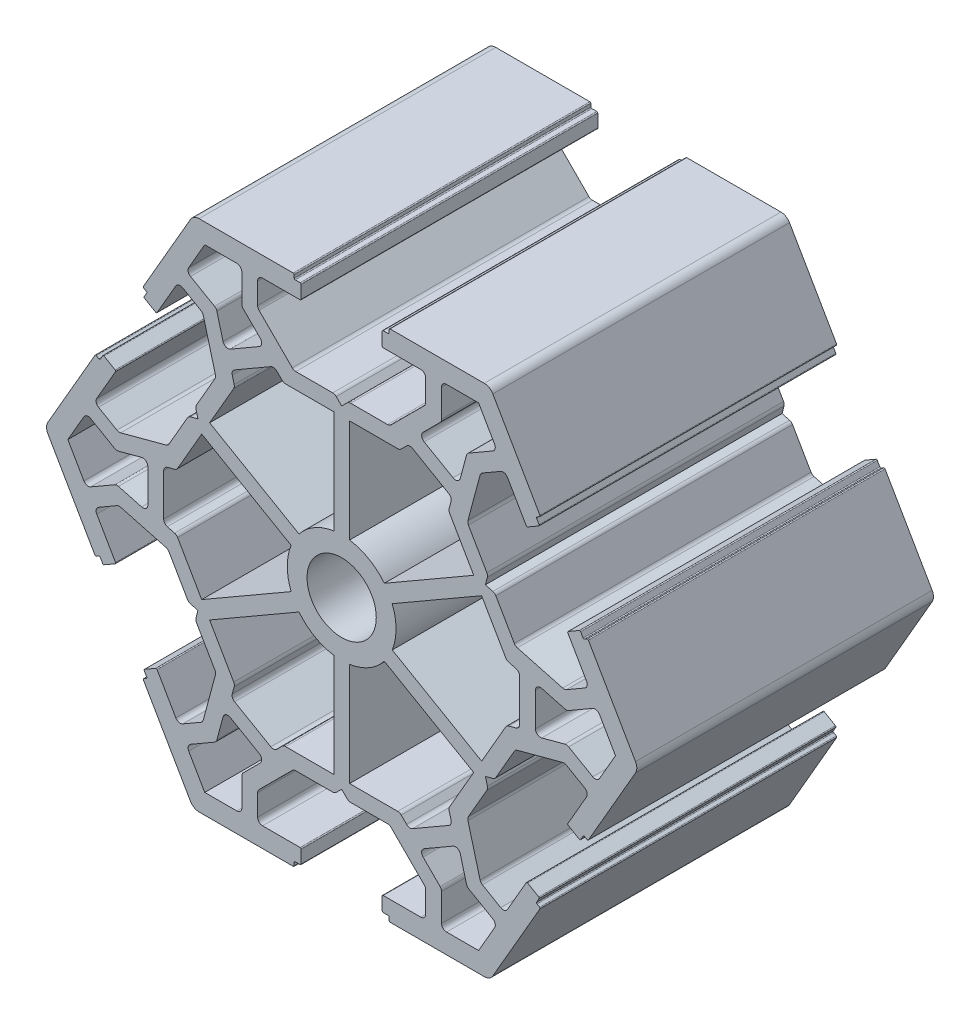
from build123d import *

# Parameters (mm, degrees)
IZIM1_R                     = 3.5
Y_KSEKLIK_EKSTR_ZYON1_DEPTH = 30


with BuildPart() as part:
    # Çizim1 → Yükseklik-Ekstrüzyon1 (new body)
    with BuildSketch(Plane.XY):
        with BuildLine():
            ThreePointArc((-14.422649731, 25.980762114), (-14.922649731, 25.846787517), (-15.288675135, 25.480762114))
            Line((-15.288675135, 25.480762114), (-20.05, 17.233905535))
            ThreePointArc((-20.05, 17.233905535), (-20.059990042, 17.158023631), (-20.01339746, 17.097302995))
            Line((-20.01339746, 17.097302995), (-19.753589838, 16.947302995))
            ThreePointArc((-19.753589838, 16.947302995), (-19.706997256, 16.886582359), (-19.716987298, 16.810700455))
            Line((-19.716987298, 16.810700455), (-19.966987298, 16.377687753))
            ThreePointArc((-19.966987298, 16.377687753), (-19.97697734, 16.301805848), (-19.930384758, 16.241085212))
            Line((-19.930384758, 16.241085212), (-18.804551733, 15.591085212))
            ThreePointArc((-18.804551733, 15.591085212), (-18.728669828, 15.58109517), (-18.667949192, 15.627687753))
            Line((-18.667949192, 15.627687753), (-16.767949192, 18.918584287))
            ThreePointArc((-16.767949192, 18.918584287), (-16.464346013, 19.1515472), (-16.084936491, 19.101596989))
            Line((-16.084936491, 19.101596989), (-14.229136525, 18.03015038))
            ThreePointArc((-14.229136525, 18.03015038), (-14.082459855, 17.901518392), (-13.996173612, 17.7265472))
            Line((-13.996173612, 17.7265472), (-12.767387247, 13.140654054))
            ThreePointArc((-12.767387247, 13.140654054), (-12.75462773, 12.945981435), (-12.817337458, 12.761244531))
            Line((-12.817337458, 12.761244531), (-14.685230677, 9.525958573))
            ThreePointArc((-14.685230677, 9.525958573), (-14.747940406, 9.341221669), (-14.735180888, 9.146549051))
            Line((-14.735180888, 9.146549051), (-14.532566285, 8.390381057))
            Line((-14.532566285, 8.390381057), (-15.288734279, 8.187766453))
            ThreePointArc((-15.288734279, 8.187766453), (-15.463705471, 8.10148021), (-15.592337458, 7.95480354))
            Line((-15.592337458, 7.95480354), (-17.460230677, 4.719517582))
            ThreePointArc((-17.460230677, 4.719517582), (-17.588862665, 4.572840912), (-17.763833857, 4.486554669))
            Line((-17.763833857, 4.486554669), (-22.349727003, 3.257768304))
            ThreePointArc((-22.349727003, 3.257768304), (-22.544399622, 3.245008786), (-22.729136525, 3.307718515))
            Line((-22.729136525, 3.307718515), (-24.584936491, 4.379165125))
            ThreePointArc((-24.584936491, 4.379165125), (-24.817899404, 4.682768304), (-24.767949192, 5.062177826))
            Line((-24.767949192, 5.062177826), (-22.867949192, 8.353074361))
            ThreePointArc((-22.867949192, 8.353074361), (-22.85795915, 8.428956265), (-22.904551733, 8.489676901))
            Line((-22.904551733, 8.489676901), (-24.030384758, 9.139676901))
            ThreePointArc((-24.030384758, 9.139676901), (-24.106266662, 9.149666944), (-24.166987298, 9.103074361))
            Line((-24.166987298, 9.103074361), (-24.416987298, 8.670061659))
            ThreePointArc((-24.416987298, 8.670061659), (-24.477707934, 8.623469076), (-24.553589838, 8.633459119))
            Line((-24.553589838, 8.633459119), (-24.81339746, 8.783459119))
            ThreePointArc((-24.81339746, 8.783459119), (-24.889279364, 8.793449161), (-24.95, 8.746856578))
            Line((-24.95, 8.746856578), (-29.711324865, 0.5))
            ThreePointArc((-29.711324865, 0.5), (-29.845299462, 0), (-29.711324865, -0.5))
            Line((-29.711324865, -0.5), (-24.95, -8.746856578))
            ThreePointArc((-24.95, -8.746856578), (-24.889279364, -8.793449161), (-24.81339746, -8.783459119))
            Line((-24.81339746, -8.783459119), (-24.553589838, -8.633459119))
            ThreePointArc((-24.553589838, -8.633459119), (-24.477707934, -8.623469076), (-24.416987298, -8.670061659))
            Line((-24.416987298, -8.670061659), (-24.166987298, -9.103074361))
            ThreePointArc((-24.166987298, -9.103074361), (-24.106266662, -9.149666944), (-24.030384758, -9.139676901))
            Line((-24.030384758, -9.139676901), (-22.904551733, -8.489676901))
            ThreePointArc((-22.904551733, -8.489676901), (-22.85795915, -8.428956265), (-22.867949192, -8.353074361))
            Line((-22.867949192, -8.353074361), (-24.767949192, -5.062177826))
            ThreePointArc((-24.767949192, -5.062177826), (-24.817899404, -4.682768304), (-24.584936491, -4.379165125))
            Line((-24.584936491, -4.379165125), (-22.729136525, -3.307718515))
            ThreePointArc((-22.729136525, -3.307718515), (-22.544399622, -3.245008786), (-22.349727003, -3.257768304))
            Line((-22.349727003, -3.257768304), (-17.763833857, -4.486554669))
            ThreePointArc((-17.763833857, -4.486554669), (-17.588862665, -4.572840912), (-17.460230677, -4.719517582))
            Line((-17.460230677, -4.719517582), (-15.592337458, -7.95480354))
            ThreePointArc((-15.592337458, -7.95480354), (-15.463705471, -8.10148021), (-15.288734279, -8.187766453))
            Line((-15.288734279, -8.187766453), (-14.532566285, -8.390381057))
            Line((-14.532566285, -8.390381057), (-14.735180888, -9.146549051))
            ThreePointArc((-14.735180888, -9.146549051), (-14.747940406, -9.341221669), (-14.685230677, -9.525958573))
            Line((-14.685230677, -9.525958573), (-12.817337458, -12.761244531))
            ThreePointArc((-12.817337458, -12.761244531), (-12.75462773, -12.945981435), (-12.767387247, -13.140654054))
            Line((-12.767387247, -13.140654054), (-13.996173612, -17.7265472))
            ThreePointArc((-13.996173612, -17.7265472), (-14.082459855, -17.901518392), (-14.229136525, -18.03015038))
            Line((-14.229136525, -18.03015038), (-16.084936491, -19.101596989))
            ThreePointArc((-16.084936491, -19.101596989), (-16.464346013, -19.1515472), (-16.767949192, -18.918584287))
            Line((-16.767949192, -18.918584287), (-18.667949192, -15.627687753))
            ThreePointArc((-18.667949192, -15.627687753), (-18.728669828, -15.58109517), (-18.804551733, -15.591085212))
            Line((-18.804551733, -15.591085212), (-19.930384758, -16.241085212))
            ThreePointArc((-19.930384758, -16.241085212), (-19.97697734, -16.301805848), (-19.966987298, -16.377687753))
            Line((-19.966987298, -16.377687753), (-19.716987298, -16.810700455))
            ThreePointArc((-19.716987298, -16.810700455), (-19.706997256, -16.886582359), (-19.753589838, -16.947302995))
            Line((-19.753589838, -16.947302995), (-20.01339746, -17.097302995))
            ThreePointArc((-20.01339746, -17.097302995), (-20.059990042, -17.158023631), (-20.05, -17.233905535))
            Line((-20.05, -17.233905535), (-15.288675135, -25.480762114))
            ThreePointArc((-15.288675135, -25.480762114), (-14.922649731, -25.846787517), (-14.422649731, -25.980762114))
            Line((-14.422649731, -25.980762114), (-4.9, -25.980762114))
            ThreePointArc((-4.9, -25.980762114), (-4.829289322, -25.951472792), (-4.8, -25.880762114))
            Line((-4.8, -25.880762114), (-4.8, -25.580762114))
            ThreePointArc((-4.8, -25.580762114), (-4.770710678, -25.510051435), (-4.7, -25.480762114))
            Line((-4.7, -25.480762114), (-4.2, -25.480762114))
            ThreePointArc((-4.2, -25.480762114), (-4.129289322, -25.451472792), (-4.1, -25.380762114))
            Line((-4.1, -25.380762114), (-4.1, -24.080762114))
            ThreePointArc((-4.1, -24.080762114), (-4.129289322, -24.010051435), (-4.2, -23.980762114))
            Line((-4.2, -23.980762114), (-8, -23.980762114))
            ThreePointArc((-8, -23.980762114), (-8.353553391, -23.834315504), (-8.5, -23.480762114))
            Line((-8.5, -23.480762114), (-8.5, -21.337868895))
            ThreePointArc((-8.5, -21.337868895), (-8.461939766, -21.146527179), (-8.353553391, -20.984315504))
            Line((-8.353553391, -20.984315504), (-4.996446609, -17.627208723))
            ThreePointArc((-4.996446609, -17.627208723), (-4.834234935, -17.518822347), (-4.642893219, -17.480762114))
            Line((-4.642893219, -17.480762114), (-0.907106781, -17.480762114))
            ThreePointArc((-0.907106781, -17.480762114), (-0.715765065, -17.44270188), (-0.553553391, -17.334315504))
            Line((-0.553553391, -17.334315504), (0, -16.780762114))
            Line((0, -16.780762114), (0.553553391, -17.334315504))
            ThreePointArc((0.553553391, -17.334315504), (0.715765065, -17.44270188), (0.907106781, -17.480762114))
            Line((0.907106781, -17.480762114), (4.642893219, -17.480762114))
            ThreePointArc((4.642893219, -17.480762114), (4.834234935, -17.518822347), (4.996446609, -17.627208723))
            Line((4.996446609, -17.627208723), (8.353553391, -20.984315504))
            ThreePointArc((8.353553391, -20.984315504), (8.461939766, -21.146527179), (8.5, -21.337868895))
            Line((8.5, -21.337868895), (8.5, -23.480762114))
            ThreePointArc((8.5, -23.480762114), (8.353553391, -23.834315504), (8, -23.980762114))
            Line((8, -23.980762114), (4.2, -23.980762114))
            ThreePointArc((4.2, -23.980762114), (4.129289322, -24.010051435), (4.1, -24.080762114))
            Line((4.1, -24.080762114), (4.1, -25.380762114))
            ThreePointArc((4.1, -25.380762114), (4.129289322, -25.451472792), (4.2, -25.480762114))
            Line((4.2, -25.480762114), (4.7, -25.480762114))
            ThreePointArc((4.7, -25.480762114), (4.770710678, -25.510051435), (4.8, -25.580762114))
            Line((4.8, -25.580762114), (4.8, -25.880762114))
            ThreePointArc((4.8, -25.880762114), (4.829289322, -25.951472792), (4.9, -25.980762114))
            Line((4.9, -25.980762114), (14.422649731, -25.980762114))
            ThreePointArc((14.422649731, -25.980762114), (14.922649731, -25.846787517), (15.288675135, -25.480762114))
            Line((15.288675135, -25.480762114), (20.05, -17.233905535))
            ThreePointArc((20.05, -17.233905535), (20.059990042, -17.158023631), (20.01339746, -17.097302995))
            Line((20.01339746, -17.097302995), (19.753589838, -16.947302995))
            ThreePointArc((19.753589838, -16.947302995), (19.706997256, -16.886582359), (19.716987298, -16.810700455))
            Line((19.716987298, -16.810700455), (19.966987298, -16.377687753))
            ThreePointArc((19.966987298, -16.377687753), (19.97697734, -16.301805848), (19.930384758, -16.241085212))
            Line((19.930384758, -16.241085212), (18.804551733, -15.591085212))
            ThreePointArc((18.804551733, -15.591085212), (18.728669828, -15.58109517), (18.667949192, -15.627687753))
            Line((18.667949192, -15.627687753), (16.767949192, -18.918584287))
            ThreePointArc((16.767949192, -18.918584287), (16.464346013, -19.1515472), (16.084936491, -19.101596989))
            Line((16.084936491, -19.101596989), (14.229136525, -18.03015038))
            ThreePointArc((14.229136525, -18.03015038), (14.082459855, -17.901518392), (13.996173612, -17.7265472))
            Line((13.996173612, -17.7265472), (12.767387247, -13.140654054))
            ThreePointArc((12.767387247, -13.140654054), (12.75462773, -12.945981435), (12.817337458, -12.761244531))
            Line((12.817337458, -12.761244531), (14.685230677, -9.525958573))
            ThreePointArc((14.685230677, -9.525958573), (14.747940406, -9.341221669), (14.735180888, -9.146549051))
            Line((14.735180888, -9.146549051), (14.532566285, -8.390381057))
            Line((14.532566285, -8.390381057), (15.288734279, -8.187766453))
            ThreePointArc((15.288734279, -8.187766453), (15.463705471, -8.10148021), (15.592337458, -7.95480354))
            Line((15.592337458, -7.95480354), (17.460230677, -4.719517582))
            ThreePointArc((17.460230677, -4.719517582), (17.588862665, -4.572840912), (17.763833857, -4.486554669))
            Line((17.763833857, -4.486554669), (22.349727003, -3.257768304))
            ThreePointArc((22.349727003, -3.257768304), (22.544399622, -3.245008786), (22.729136525, -3.307718515))
            Line((22.729136525, -3.307718515), (24.584936491, -4.379165125))
            ThreePointArc((24.584936491, -4.379165125), (24.817899404, -4.682768304), (24.767949192, -5.062177826))
            Line((24.767949192, -5.062177826), (22.867949192, -8.353074361))
            ThreePointArc((22.867949192, -8.353074361), (22.85795915, -8.428956265), (22.904551733, -8.489676901))
            Line((22.904551733, -8.489676901), (24.030384758, -9.139676901))
            ThreePointArc((24.030384758, -9.139676901), (24.106266662, -9.149666944), (24.166987298, -9.103074361))
            Line((24.166987298, -9.103074361), (24.416987298, -8.670061659))
            ThreePointArc((24.416987298, -8.670061659), (24.477707934, -8.623469076), (24.553589838, -8.633459119))
            Line((24.553589838, -8.633459119), (24.81339746, -8.783459119))
            ThreePointArc((24.81339746, -8.783459119), (24.889279364, -8.793449161), (24.95, -8.746856578))
            Line((24.95, -8.746856578), (29.711324865, -0.5))
            ThreePointArc((29.711324865, -0.5), (29.845299462, 0), (29.711324865, 0.5))
            Line((29.711324865, 0.5), (24.95, 8.746856578))
            ThreePointArc((24.95, 8.746856578), (24.889279364, 8.793449161), (24.81339746, 8.783459119))
            Line((24.81339746, 8.783459119), (24.553589838, 8.633459119))
            ThreePointArc((24.553589838, 8.633459119), (24.477707934, 8.623469076), (24.416987298, 8.670061659))
            Line((24.416987298, 8.670061659), (24.166987298, 9.103074361))
            ThreePointArc((24.166987298, 9.103074361), (24.106266662, 9.149666944), (24.030384758, 9.139676901))
            Line((24.030384758, 9.139676901), (22.904551733, 8.489676901))
            ThreePointArc((22.904551733, 8.489676901), (22.85795915, 8.428956265), (22.867949192, 8.353074361))
            Line((22.867949192, 8.353074361), (24.767949192, 5.062177826))
            ThreePointArc((24.767949192, 5.062177826), (24.817899404, 4.682768304), (24.584936491, 4.379165125))
            Line((24.584936491, 4.379165125), (22.729136525, 3.307718515))
            ThreePointArc((22.729136525, 3.307718515), (22.544399622, 3.245008786), (22.349727003, 3.257768304))
            Line((22.349727003, 3.257768304), (17.763833857, 4.486554669))
            ThreePointArc((17.763833857, 4.486554669), (17.588862665, 4.572840912), (17.460230677, 4.719517582))
            Line((17.460230677, 4.719517582), (15.592337458, 7.95480354))
            ThreePointArc((15.592337458, 7.95480354), (15.463705471, 8.10148021), (15.288734279, 8.187766453))
            Line((15.288734279, 8.187766453), (14.532566285, 8.390381057))
            Line((14.532566285, 8.390381057), (14.735180888, 9.146549051))
            ThreePointArc((14.735180888, 9.146549051), (14.747940406, 9.341221669), (14.685230677, 9.525958573))
            Line((14.685230677, 9.525958573), (12.817337458, 12.761244531))
            ThreePointArc((12.817337458, 12.761244531), (12.75462773, 12.945981435), (12.767387247, 13.140654054))
            Line((12.767387247, 13.140654054), (13.996173612, 17.7265472))
            ThreePointArc((13.996173612, 17.7265472), (14.082459855, 17.901518392), (14.229136525, 18.03015038))
            Line((14.229136525, 18.03015038), (16.084936491, 19.101596989))
            ThreePointArc((16.084936491, 19.101596989), (16.464346013, 19.1515472), (16.767949192, 18.918584287))
            Line((16.767949192, 18.918584287), (18.667949192, 15.627687753))
            ThreePointArc((18.667949192, 15.627687753), (18.728669828, 15.58109517), (18.804551733, 15.591085212))
            Line((18.804551733, 15.591085212), (19.930384758, 16.241085212))
            ThreePointArc((19.930384758, 16.241085212), (19.97697734, 16.301805848), (19.966987298, 16.377687753))
            Line((19.966987298, 16.377687753), (19.716987298, 16.810700455))
            ThreePointArc((19.716987298, 16.810700455), (19.706997256, 16.886582359), (19.753589838, 16.947302995))
            Line((19.753589838, 16.947302995), (20.01339746, 17.097302995))
            ThreePointArc((20.01339746, 17.097302995), (20.059990042, 17.158023631), (20.05, 17.233905535))
            Line((20.05, 17.233905535), (15.288675135, 25.480762114))
            ThreePointArc((15.288675135, 25.480762114), (14.922649731, 25.846787517), (14.422649731, 25.980762114))
            Line((14.422649731, 25.980762114), (4.9, 25.980762114))
            ThreePointArc((4.9, 25.980762114), (4.829289322, 25.951472792), (4.8, 25.880762114))
            Line((4.8, 25.880762114), (4.8, 25.580762114))
            ThreePointArc((4.8, 25.580762114), (4.770710678, 25.510051435), (4.7, 25.480762114))
            Line((4.7, 25.480762114), (4.2, 25.480762114))
            ThreePointArc((4.2, 25.480762114), (4.129289322, 25.451472792), (4.1, 25.380762114))
            Line((4.1, 25.380762114), (4.1, 24.080762114))
            ThreePointArc((4.1, 24.080762114), (4.129289322, 24.010051435), (4.2, 23.980762114))
            Line((4.2, 23.980762114), (8, 23.980762114))
            ThreePointArc((8, 23.980762114), (8.353553391, 23.834315504), (8.5, 23.480762114))
            Line((8.5, 23.480762114), (8.5, 21.337868895))
            ThreePointArc((8.5, 21.337868895), (8.461939766, 21.146527179), (8.353553391, 20.984315504))
            Line((8.353553391, 20.984315504), (4.996446609, 17.627208723))
            ThreePointArc((4.996446609, 17.627208723), (4.834234935, 17.518822347), (4.642893219, 17.480762114))
            Line((4.642893219, 17.480762114), (0.907106781, 17.480762114))
            ThreePointArc((0.907106781, 17.480762114), (0.715765065, 17.44270188), (0.553553391, 17.334315504))
            Line((0.553553391, 17.334315504), (0, 16.780762114))
            Line((0, 16.780762114), (-0.553553391, 17.334315504))
            ThreePointArc((-0.553553391, 17.334315504), (-0.715765065, 17.44270188), (-0.907106781, 17.480762114))
            Line((-0.907106781, 17.480762114), (-4.642893219, 17.480762114))
            ThreePointArc((-4.642893219, 17.480762114), (-4.834234935, 17.518822347), (-4.996446609, 17.627208723))
            Line((-4.996446609, 17.627208723), (-8.353553391, 20.984315504))
            ThreePointArc((-8.353553391, 20.984315504), (-8.461939766, 21.146527179), (-8.5, 21.337868895))
            Line((-8.5, 21.337868895), (-8.5, 23.480762114))
            ThreePointArc((-8.5, 23.480762114), (-8.353553391, 23.834315504), (-8, 23.980762114))
            Line((-8, 23.980762114), (-4.2, 23.980762114))
            ThreePointArc((-4.2, 23.980762114), (-4.129289322, 24.010051435), (-4.1, 24.080762114))
            Line((-4.1, 24.080762114), (-4.1, 25.380762114))
            ThreePointArc((-4.1, 25.380762114), (-4.129289322, 25.451472792), (-4.2, 25.480762114))
            Line((-4.2, 25.480762114), (-4.7, 25.480762114))
            ThreePointArc((-4.7, 25.480762114), (-4.770710678, 25.510051435), (-4.8, 25.580762114))
            Line((-4.8, 25.580762114), (-4.8, 25.880762114))
            ThreePointArc((-4.8, 25.880762114), (-4.829289322, 25.951472792), (-4.9, 25.980762114))
            Line((-4.9, 25.980762114), (-14.422649731, 25.980762114))
        make_face()
        with BuildLine():
            Line((-10.6, -23.980762114), (-13.845299462, -23.980762114))
            Line((-13.845299462, -23.980762114), (-15.467949192, -21.170250337))
            ThreePointArc((-15.467949192, -21.170250337), (-15.517899404, -20.790840814), (-15.284936491, -20.487237635))
            Line((-15.284936491, -20.487237635), (-12.855185377, -19.084420176))
            ThreePointArc((-12.855185377, -19.084420176), (-12.708508707, -18.955788188), (-12.622222464, -18.780816996))
            Line((-12.622222464, -18.780816996), (-11.9935155, -16.434450664))
            ThreePointArc((-11.9935155, -16.434450664), (-11.701894303, -16.10192042), (-11.260552587, -16.130847485))
            Line((-11.260552587, -16.130847485), (-8.339447413, -17.817348344))
            ThreePointArc((-8.339447413, -17.817348344), (-8.093724982, -18.185097949), (-8.235894022, -18.603914436))
            Line((-8.235894022, -18.603914436), (-9.953553391, -20.321573804))
            ThreePointArc((-9.953553391, -20.321573804), (-10.061939766, -20.483785479), (-10.1, -20.675127195))
            Line((-10.1, -20.675127195), (-10.1, -23.480762114))
            ThreePointArc((-10.1, -23.480762114), (-10.246446609, -23.834315504), (-10.6, -23.980762114))
        make_face(mode=Mode.SUBTRACT)
        with BuildLine():
            Line((15.467949192, -21.170250337), (13.845299462, -23.980762114))
            Line((13.845299462, -23.980762114), (10.6, -23.980762114))
            ThreePointArc((10.6, -23.980762114), (10.246446609, -23.834315504), (10.1, -23.480762114))
            Line((10.1, -23.480762114), (10.1, -20.675127195))
            ThreePointArc((10.1, -20.675127195), (10.061939766, -20.483785479), (9.953553391, -20.321573804))
            Line((9.953553391, -20.321573804), (8.235894022, -18.603914436))
            ThreePointArc((8.235894022, -18.603914436), (8.093724982, -18.185097949), (8.339447413, -17.817348344))
            Line((8.339447413, -17.817348344), (11.260552587, -16.130847485))
            ThreePointArc((11.260552587, -16.130847485), (11.701894303, -16.10192042), (11.9935155, -16.434450664))
            Line((11.9935155, -16.434450664), (12.622222464, -18.780816996))
            ThreePointArc((12.622222464, -18.780816996), (12.708508707, -18.955788188), (12.855185377, -19.084420176))
            Line((12.855185377, -19.084420176), (15.284936491, -20.487237635))
            ThreePointArc((15.284936491, -20.487237635), (15.517899404, -20.790840814), (15.467949192, -21.170250337))
        make_face(mode=Mode.SUBTRACT)
        with BuildLine():
            Line((-4.312483422, 3.413573895), (-13.353143422, 8.63320138))
            Line((-13.353143422, 8.63320138), (-10.918076144, 12.850861624))
            ThreePointArc((-10.918076144, 12.850861624), (-10.855366416, 13.035598528), (-10.868125933, 13.230271147))
            Line((-10.868125933, 13.230271147), (-11.06576409, 13.967866791))
            ThreePointArc((-11.06576409, 13.967866791), (-11.044740943, 14.288618029), (-10.832801177, 14.530289015))
            Line((-10.832801177, 14.530289015), (-9, 15.588457268))
            Line((-9, 15.588457268), (-7.167198823, 16.646625521))
            ThreePointArc((-7.167198823, 16.646625521), (-6.851935727, 16.70933525), (-6.563645432, 16.56716621))
            Line((-6.563645432, 16.56716621), (-6.023687945, 16.027208723))
            ThreePointArc((-6.023687945, 16.027208723), (-5.861476271, 15.918822347), (-5.670134555, 15.880762114))
            Line((-5.670134555, 15.880762114), (-0.8, 15.880762114))
            Line((-0.8, 15.880762114), (-0.8, 5.441507144))
            ThreePointArc((-0.8, 5.441507144), (-2.75, 4.763139721), (-4.312483422, 3.413573895))
        make_face(mode=Mode.SUBTRACT)
        with BuildLine():
            Line((-14.153143422, 7.247560734), (-5.112483422, 2.027933249))
            ThreePointArc((-5.112483422, 2.027933249), (-5.5, 0), (-5.112483422, -2.027933249))
            Line((-5.112483422, -2.027933249), (-14.153143422, -7.247560734))
            Line((-14.153143422, -7.247560734), (-16.588210699, -3.029900489))
            ThreePointArc((-16.588210699, -3.029900489), (-16.716842687, -2.883223819), (-16.891813879, -2.796937576))
            Line((-16.891813879, -2.796937576), (-17.629409523, -2.599299419))
            ThreePointArc((-17.629409523, -2.599299419), (-17.89667667, -2.420717221), (-18, -2.116336506))
            Line((-18, -2.116336506), (-18, 2.116336506))
            ThreePointArc((-18, 2.116336506), (-17.89667667, 2.420717221), (-17.629409523, 2.599299419))
            Line((-17.629409523, 2.599299419), (-16.891813879, 2.796937576))
            ThreePointArc((-16.891813879, 2.796937576), (-16.716842687, 2.883223819), (-16.588210699, 3.029900489))
            Line((-16.588210699, 3.029900489), (-14.153143422, 7.247560734))
        make_face(mode=Mode.SUBTRACT)
        with BuildLine():
            Line((-13.353143422, -8.63320138), (-4.312483422, -3.413573895))
            ThreePointArc((-4.312483422, -3.413573895), (-2.75, -4.763139721), (-0.8, -5.441507144))
            Line((-0.8, -5.441507144), (-0.8, -15.880762114))
            Line((-0.8, -15.880762114), (-5.670134555, -15.880762114))
            ThreePointArc((-5.670134555, -15.880762114), (-5.861476271, -15.918822347), (-6.023687945, -16.027208723))
            Line((-6.023687945, -16.027208723), (-6.563645432, -16.56716621))
            ThreePointArc((-6.563645432, -16.56716621), (-6.851935727, -16.70933525), (-7.167198823, -16.646625521))
            Line((-7.167198823, -16.646625521), (-10.832801177, -14.530289015))
            ThreePointArc((-10.832801177, -14.530289015), (-11.044740943, -14.288618029), (-11.06576409, -13.967866791))
            Line((-11.06576409, -13.967866791), (-10.868125933, -13.230271147))
            ThreePointArc((-10.868125933, -13.230271147), (-10.855366416, -13.035598528), (-10.918076144, -12.850861624))
            Line((-10.918076144, -12.850861624), (-13.353143422, -8.63320138))
        make_face(mode=Mode.SUBTRACT)
        with BuildLine():
            Line((0.8, -15.880762114), (0.8, -5.441507144))
            ThreePointArc((0.8, -5.441507144), (2.75, -4.763139721), (4.312483422, -3.413573895))
            Line((4.312483422, -3.413573895), (13.353143422, -8.63320138))
            Line((13.353143422, -8.63320138), (10.918076144, -12.850861624))
            ThreePointArc((10.918076144, -12.850861624), (10.855366416, -13.035598528), (10.868125933, -13.230271147))
            Line((10.868125933, -13.230271147), (11.06576409, -13.967866791))
            ThreePointArc((11.06576409, -13.967866791), (11.044740943, -14.288618029), (10.832801177, -14.530289015))
            Line((10.832801177, -14.530289015), (7.167198823, -16.646625521))
            ThreePointArc((7.167198823, -16.646625521), (6.851935727, -16.70933525), (6.563645432, -16.56716621))
            Line((6.563645432, -16.56716621), (6.023687945, -16.027208723))
            ThreePointArc((6.023687945, -16.027208723), (5.861476271, -15.918822347), (5.670134555, -15.880762114))
            Line((5.670134555, -15.880762114), (0.8, -15.880762114))
        make_face(mode=Mode.SUBTRACT)
        with BuildLine():
            Line((14.153143422, -7.247560734), (5.112483422, -2.027933249))
            ThreePointArc((5.112483422, -2.027933249), (5.5, 0), (5.112483422, 2.027933249))
            Line((5.112483422, 2.027933249), (14.153143422, 7.247560734))
            Line((14.153143422, 7.247560734), (16.588210699, 3.029900489))
            ThreePointArc((16.588210699, 3.029900489), (16.716842687, 2.883223819), (16.891813879, 2.796937576))
            Line((16.891813879, 2.796937576), (17.629409523, 2.599299419))
            ThreePointArc((17.629409523, 2.599299419), (17.89667667, 2.420717221), (18, 2.116336506))
            Line((18, 2.116336506), (18, -2.116336506))
            ThreePointArc((18, -2.116336506), (17.89667667, -2.420717221), (17.629409523, -2.599299419))
            Line((17.629409523, -2.599299419), (16.891813879, -2.796937576))
            ThreePointArc((16.891813879, -2.796937576), (16.716842687, -2.883223819), (16.588210699, -3.029900489))
            Line((16.588210699, -3.029900489), (14.153143422, -7.247560734))
        make_face(mode=Mode.SUBTRACT)
        with BuildLine():
            Line((13.353143422, 8.63320138), (4.312483422, 3.413573895))
            ThreePointArc((4.312483422, 3.413573895), (2.75, 4.763139721), (0.8, 5.441507144))
            Line((0.8, 5.441507144), (0.8, 15.880762114))
            Line((0.8, 15.880762114), (5.670134555, 15.880762114))
            ThreePointArc((5.670134555, 15.880762114), (5.861476271, 15.918822347), (6.023687945, 16.027208723))
            Line((6.023687945, 16.027208723), (6.563645432, 16.56716621))
            ThreePointArc((6.563645432, 16.56716621), (6.851935727, 16.70933525), (7.167198823, 16.646625521))
            Line((7.167198823, 16.646625521), (10.832801177, 14.530289015))
            ThreePointArc((10.832801177, 14.530289015), (11.044740943, 14.288618029), (11.06576409, 13.967866791))
            Line((11.06576409, 13.967866791), (10.868125933, 13.230271147))
            ThreePointArc((10.868125933, 13.230271147), (10.855366416, 13.035598528), (10.918076144, 12.850861624))
            Line((10.918076144, 12.850861624), (13.353143422, 8.63320138))
        make_face(mode=Mode.SUBTRACT)
        with BuildLine():
            Line((26.067949192, 2.810511777), (27.690598923, 0))
            Line((27.690598923, 0), (26.067949192, -2.810511777))
            ThreePointArc((26.067949192, -2.810511777), (25.764346013, -3.04347469), (25.384936491, -2.993524479))
            Line((25.384936491, -2.993524479), (22.955185377, -1.590707019))
            ThreePointArc((22.955185377, -1.590707019), (22.770448473, -1.52799729), (22.575775855, -1.540756808))
            Line((22.575775855, -1.540756808), (20.229409523, -2.169463772))
            ThreePointArc((20.229409523, -2.169463772), (19.795619285, -2.083177529), (19.6, -1.686500859))
            Line((19.6, -1.686500859), (19.6, 1.686500859))
            ThreePointArc((19.6, 1.686500859), (19.795619285, 2.083177529), (20.229409523, 2.169463772))
            Line((20.229409523, 2.169463772), (22.575775855, 1.540756808))
            ThreePointArc((22.575775855, 1.540756808), (22.770448473, 1.52799729), (22.955185377, 1.590707019))
            Line((22.955185377, 1.590707019), (25.384936491, 2.993524479))
            ThreePointArc((25.384936491, 2.993524479), (25.764346013, 3.04347469), (26.067949192, 2.810511777))
        make_face(mode=Mode.SUBTRACT)
        with BuildLine():
            Line((-26.067949192, -2.810511777), (-27.690598923, 0))
            Line((-27.690598923, 0), (-26.067949192, 2.810511777))
            ThreePointArc((-26.067949192, 2.810511777), (-25.764346013, 3.04347469), (-25.384936491, 2.993524479))
            Line((-25.384936491, 2.993524479), (-22.955185377, 1.590707019))
            ThreePointArc((-22.955185377, 1.590707019), (-22.770448473, 1.52799729), (-22.575775855, 1.540756808))
            Line((-22.575775855, 1.540756808), (-20.229409523, 2.169463772))
            ThreePointArc((-20.229409523, 2.169463772), (-19.795619285, 2.083177529), (-19.6, 1.686500859))
            Line((-19.6, 1.686500859), (-19.6, -1.686500859))
            ThreePointArc((-19.6, -1.686500859), (-19.795619285, -2.083177529), (-20.229409523, -2.169463772))
            Line((-20.229409523, -2.169463772), (-22.575775855, -1.540756808))
            ThreePointArc((-22.575775855, -1.540756808), (-22.770448473, -1.52799729), (-22.955185377, -1.590707019))
            Line((-22.955185377, -1.590707019), (-25.384936491, -2.993524479))
            ThreePointArc((-25.384936491, -2.993524479), (-25.764346013, -3.04347469), (-26.067949192, -2.810511777))
        make_face(mode=Mode.SUBTRACT)
        with BuildLine():
            Line((-8.339447413, 17.817348344), (-9.8, 16.974097914))
            Line((-9.8, 16.974097914), (-11.260552587, 16.130847485))
            ThreePointArc((-11.260552587, 16.130847485), (-11.701894303, 16.10192042), (-11.9935155, 16.434450664))
            Line((-11.9935155, 16.434450664), (-12.622222464, 18.780816996))
            ThreePointArc((-12.622222464, 18.780816996), (-12.708508707, 18.955788188), (-12.855185377, 19.084420176))
            Line((-12.855185377, 19.084420176), (-15.284936491, 20.487237635))
            ThreePointArc((-15.284936491, 20.487237635), (-15.517899404, 20.790840814), (-15.467949192, 21.170250337))
            Line((-15.467949192, 21.170250337), (-13.845299462, 23.980762114))
            Line((-13.845299462, 23.980762114), (-10.6, 23.980762114))
            ThreePointArc((-10.6, 23.980762114), (-10.246446609, 23.834315504), (-10.1, 23.480762114))
            Line((-10.1, 23.480762114), (-10.1, 20.675127195))
            ThreePointArc((-10.1, 20.675127195), (-10.061939766, 20.483785479), (-9.953553391, 20.321573804))
            Line((-9.953553391, 20.321573804), (-8.235894022, 18.603914436))
            ThreePointArc((-8.235894022, 18.603914436), (-8.093724982, 18.185097949), (-8.339447413, 17.817348344))
        make_face(mode=Mode.SUBTRACT)
        with BuildLine():
            Line((10.6, 23.980762114), (13.845299462, 23.980762114))
            Line((13.845299462, 23.980762114), (15.467949192, 21.170250337))
            ThreePointArc((15.467949192, 21.170250337), (15.517899404, 20.790840814), (15.284936491, 20.487237635))
            Line((15.284936491, 20.487237635), (12.855185377, 19.084420176))
            ThreePointArc((12.855185377, 19.084420176), (12.708508707, 18.955788188), (12.622222464, 18.780816996))
            Line((12.622222464, 18.780816996), (11.9935155, 16.434450664))
            ThreePointArc((11.9935155, 16.434450664), (11.701894303, 16.10192042), (11.260552587, 16.130847485))
            Line((11.260552587, 16.130847485), (8.339447413, 17.817348344))
            ThreePointArc((8.339447413, 17.817348344), (8.093724982, 18.185097949), (8.235894022, 18.603914436))
            Line((8.235894022, 18.603914436), (9.953553391, 20.321573804))
            ThreePointArc((9.953553391, 20.321573804), (10.061939766, 20.483785479), (10.1, 20.675127195))
            Line((10.1, 20.675127195), (10.1, 23.480762114))
            ThreePointArc((10.1, 23.480762114), (10.246446609, 23.834315504), (10.6, 23.980762114))
        make_face(mode=Mode.SUBTRACT)
        Circle(IZIM1_R, mode=Mode.SUBTRACT)
    extrude(amount=Y_KSEKLIK_EKSTR_ZYON1_DEPTH)


solid = part.part
